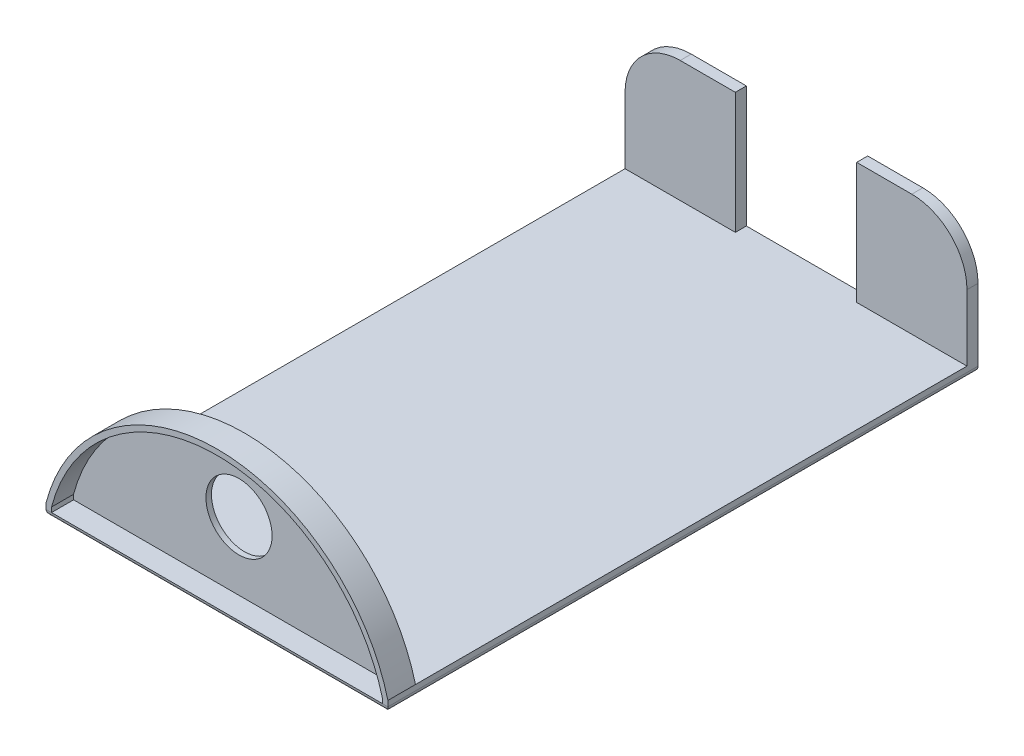
from build123d import *

# Parameters (mm, degrees)
BOSS_EXTRUDE1_DEPTH = 2
SKETCH4_W           = 62
SKETCH4_H           = 2
BOSS_EXTRUDE2_DEPTH = 100
BOSS_EXTRUDE3_DEPTH = 5
SHELL1_START        = 103
SHELL1_DEPTH        = 4
FILLET1_R           = 1
SKETCH7_R           = 6
CUT_EXTRUDE1_DEPTH  = 2
FILLET2_R           = 10
FILLET3_R           = 10


# Read off the part's stored shape, not the designer's step: Shell1
with BuildPart() as part:
    # Sketch3 → Boss-Extrude1 (new body)
    with BuildSketch(Plane.XY):
        Polygon((0, 0), (0, 24), (20, 24), (20, 2), (42, 2), (42, 24), (62, 24), (62, 0), align=None)
    extrude(amount=BOSS_EXTRUDE1_DEPTH)

    # Sketch4 → Boss-Extrude2 (add)
    with BuildSketch(Plane.XY.offset(2)):
        with Locations((31, 1)):
            Rectangle(SKETCH4_W, SKETCH4_H)
    extrude(amount=BOSS_EXTRUDE2_DEPTH)

    # Sketch6 → Boss-Extrude3 (add)
    with BuildSketch(Plane.XY.offset(102)):
        with BuildLine():
            Line((0, 2), (0, 0))
            Line((0, 0), (62, 0))
            Line((62, 0), (62, 2))
            ThreePointArc((62, 2), (31, 25.997977773), (0, 2))
        make_face()
    extrude(amount=BOSS_EXTRUDE3_DEPTH)

    # Shell1 outline → Shell1 (cut)
    with BuildSketch(Plane.XY.offset(SHELL1_START)):
        with BuildLine():
            Line((1, 1), (61, 1))
            Line((61, 1), (61, 1.871659386))
            ThreePointArc((61, 1.871659386), (31, 24.997977773), (1, 1.871659386))
            Line((1, 1.871659386), (1, 1))
        make_face()
    extrude(amount=SHELL1_DEPTH, mode=Mode.SUBTRACT)

    # Fillet1
    fillet1_edges = [part.edges().sort_by_distance(p)[0] for p in [
        (0, 0, 53.5),
        (62, 0, 53.5),
        (31, 0, 107),
    ]]
    fillet(fillet1_edges, radius=FILLET1_R - 0.0001)  # a hair under: the kernel refuses the full size

    # Sketch7 → Cut-Extrude1 (cut)
    with BuildSketch(Plane.XY.offset(103)):
        with Locations((31, 13.343458138)):
            Circle(SKETCH7_R)
    extrude(amount=-CUT_EXTRUDE1_DEPTH, mode=Mode.SUBTRACT)

    # Fillet2
    fillet2_edges = [part.edges().sort_by_distance(p)[0] for p in [
        (0, 24, 1),
    ]]
    fillet(fillet2_edges, radius=FILLET2_R)

    # Fillet3
    fillet3_edges = [part.edges().sort_by_distance(p)[0] for p in [
        (62, 24, 1),
    ]]
    fillet(fillet3_edges, radius=FILLET3_R)


solid = part.part
